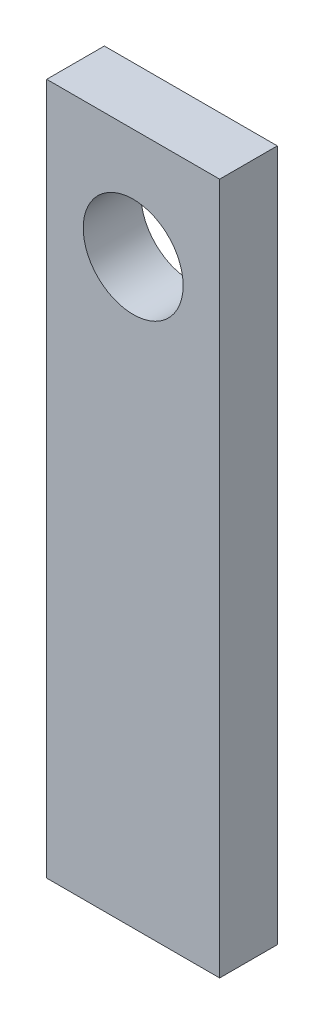
from build123d import *

# Parameters (mm, degrees)
ESQUISSE1_W        = 9
ESQUISSE1_H        = 36
ESQUISSE1_R        = 2.6
BOSS_EXTRU_1_DEPTH = 3


with BuildPart() as part:
    # Esquisse1 → Boss.-Extru.1 (new body)
    with BuildSketch(Plane.XY):
        with Locations((-4.5, 18)):
            Rectangle(ESQUISSE1_W, ESQUISSE1_H)
        with Locations((-4.5, 30.25)):
            Circle(ESQUISSE1_R, mode=Mode.SUBTRACT)
    extrude(amount=BOSS_EXTRU_1_DEPTH)


solid = part.part
